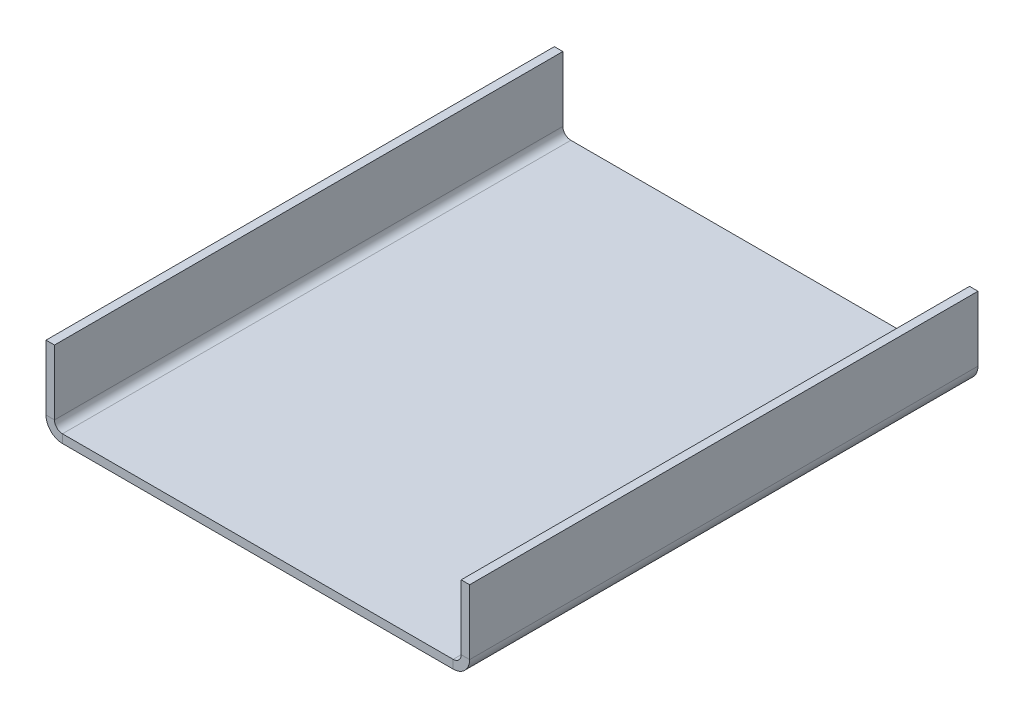
from build123d import *

# Parameters (mm, degrees)
BASE_FLANGE1_DEPTH = 190.5


# Sheet-metal steps are written as plain solids
with BuildPart() as part:
    # Sketch1 → Base-Flange1 (new body)
    with BuildSketch(Plane.XY):
        with BuildLine():
            Line((79.375, 15.24), (79.375, -9.065))
            ThreePointArc((79.375, -9.065), (77.566384374, -13.431384374), (73.2, -15.24))
            Line((73.2, -15.24), (-73.2, -15.24))
            ThreePointArc((-73.2, -15.24), (-77.566384374, -13.431384374), (-79.375, -9.065))
            Line((-79.375, -9.065), (-79.375, 15.24))
            Line((-79.375, 15.24), (-76.2, 15.24))
            Line((-76.2, 15.24), (-76.2, -9.065))
            ThreePointArc((-76.2, -9.065), (-75.321320344, -11.186320344), (-73.2, -12.065))
            Line((-73.2, -12.065), (73.2, -12.065))
            ThreePointArc((73.2, -12.065), (75.321320344, -11.186320344), (76.2, -9.065))
            Line((76.2, -9.065), (76.2, 15.24))
            Line((76.2, 15.24), (79.375, 15.24))
        make_face()
    extrude(amount=BASE_FLANGE1_DEPTH)


solid = part.part
